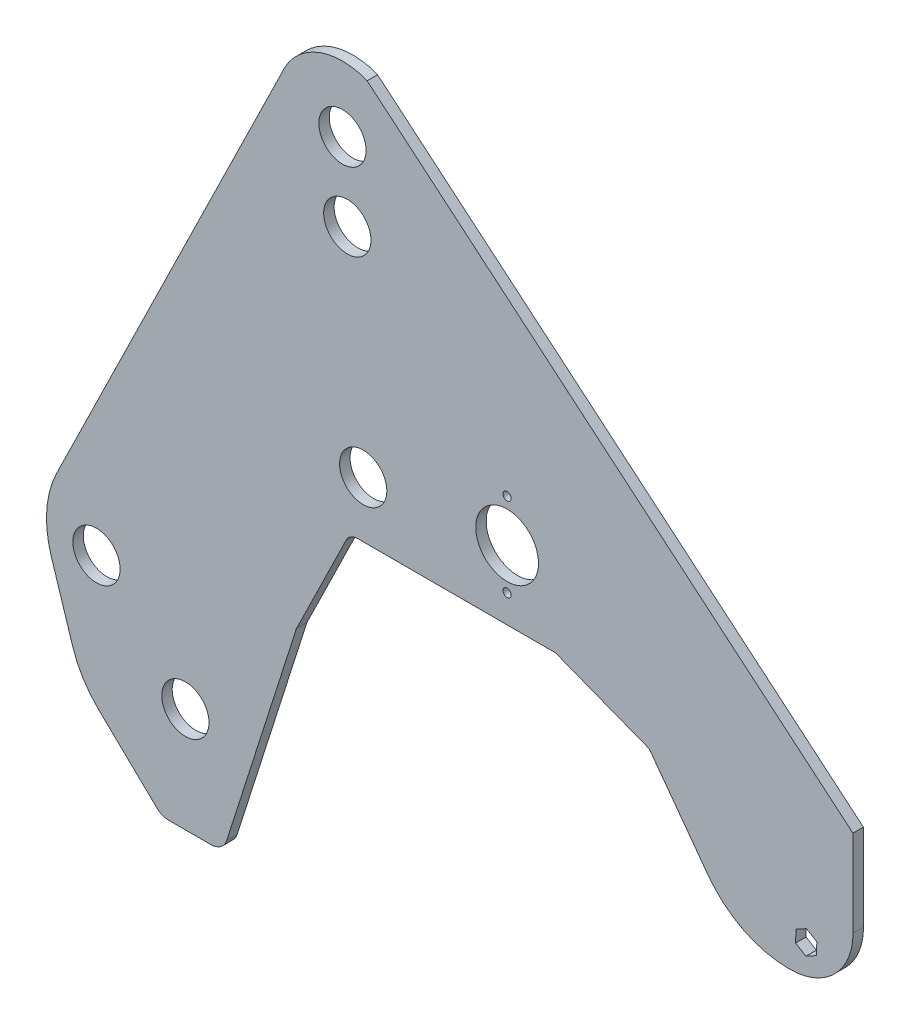
from build123d import *

# Parameters (mm, degrees)
MODEL_R             = 14.351
MODEL_R_2           = 2.4892
MODEL_R_3           = 19.05
BOSS_EXTRUDE1_DEPTH = 6.35


with BuildPart() as part:
    # Model → Boss-Extrude1 (new body)
    with BuildSketch(Plane.XY):
        with BuildLine():
            ThreePointArc((37.848526687, 2.262029163), (64.80634408, 13.438320625), (75.948496151, 40.41026636))
            Line((75.948496151, 40.41026636), (75.881988378, 92.941181044))
            Line((75.881988378, 92.941181044), (-219.021530087, 341.013342972))
            ThreePointArc((-219.021530087, 341.013342972), (-249.598102613, 340.75613417), (-271.005223477, 318.922029653))
            Line((-271.005223477, 318.922029653), (-407.447947906, 40.562687258))
            ThreePointArc((-407.447947906, 40.562687258), (-413.504414836, 18.223168878), (-410.796463755, -4.763824707))
            Line((-410.796463755, -4.763824707), (-397.757866664, -45.711795582))
            ThreePointArc((-397.757866664, -45.711795582), (-391.428206492, -59.42413889), (-381.921754905, -71.15956965))
            Line((-381.921754905, -71.15956965), (-346.581655077, -105.137897494))
            ThreePointArc((-346.581655077, -105.137897494), (-343.33563244, -107.238319484), (-339.539943756, -107.973970837))
            Line((-339.539943756, -107.973970837), (-313.913508761, -107.973970837))
            ThreePointArc((-313.913508761, -107.973970837), (-307.920765687, -106.018398329), (-304.234960332, -100.904488644))
            Line((-304.234960332, -100.904488644), (-261.934247982, 31.568293798))
            Line((-261.934247982, 31.568293798), (-231.724911987, 93.198922598))
            ThreePointArc((-231.724911987, 93.198922598), (-228.914312262, 96.311172873), (-224.882679008, 97.465081836))
            Line((-224.882679008, 97.465081836), (-104.724911987, 97.465081836))
            Line((-104.724911987, 97.465081836), (-47.735381384, 75.435922823))
            Line((-47.735381384, 75.435922823), (-12.19046228, 27.104984512))
            ThreePointArc((-12.19046228, 27.104984512), (9.400894782, 8.826180783), (36.918403373, 2.262029163))
            Line((36.918403373, 2.262029163), (37.848526687, 2.262029163))
        make_face()
        with Locations((-329.349093547, -44.473970837)):
            Circle(MODEL_R, mode=Mode.SUBTRACT)
        with Locations((-383.32390783, 9.314126574)):
            Circle(MODEL_R, mode=Mode.SUBTRACT)
        with Locations((-134.044120223, 114.3)):
            Circle(MODEL_R_2, mode=Mode.SUBTRACT)
        Polygon((47.675088013, 28.642798274), (53.94763224, 24.845625345), (53.795456135, 17.514856234), (47.370735802, 13.981260051), (41.098191575, 17.77843298), (41.25036768, 25.109202091), align=None, mode=Mode.SUBTRACT)
        with Locations((-221.405162748, 131.331748503)):
            Circle(MODEL_R, mode=Mode.SUBTRACT)
        with Locations((-231.048860216, 258.331748503)):
            Circle(MODEL_R, mode=Mode.SUBTRACT)
        with Locations((-233.999978834, 304.051748503)):
            Circle(MODEL_R, mode=Mode.SUBTRACT)
        with Locations((-134.044120223, 139.287851019)):
            Circle(MODEL_R_3, mode=Mode.SUBTRACT)
        with Locations((-134.044120223, 165.1)):
            Circle(MODEL_R_2, mode=Mode.SUBTRACT)
    extrude(amount=BOSS_EXTRUDE1_DEPTH)


solid = part.part
